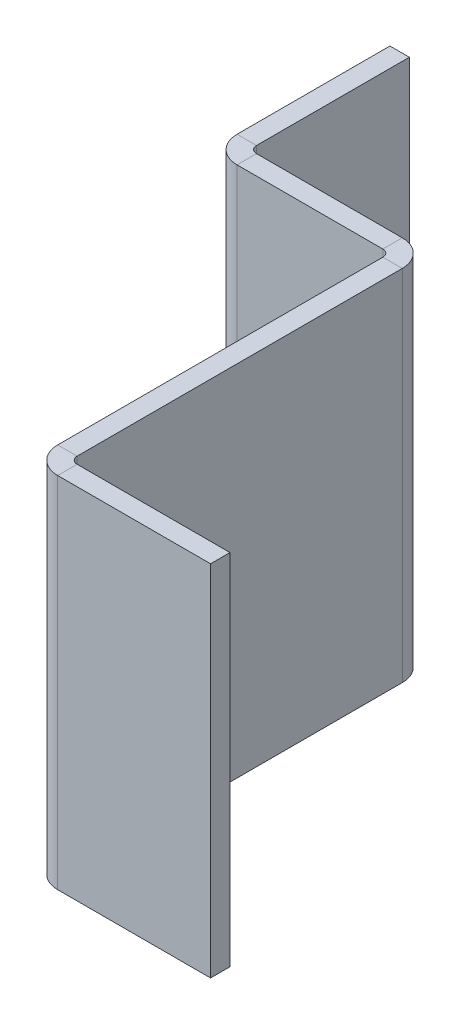
from build123d import *

# Parameters (mm, degrees)
BOSS_EXTRUDE1_DEPTH    = 50.8
CONVERT_SOLID3_DEPTH   = 50.8
CONVERT_SOLID3_2_DEPTH = 50.8


# Read off the part's stored shape, not the designer's step: Convert-Solid3
with BuildPart() as part:
    # Sketch1 → Boss-Extrude1 (new body)
    with BuildSketch(Plane(origin=(0, 0, 0), x_dir=(1, 0, 0), z_dir=(0, 1, 0))):
        Polygon((-9.94664, 28.15336), (15.45336, 28.15336), (15.45336, -22.64664), (38.1, -22.64664), (38.1, -25.4), (12.7, -25.4), (12.7, 25.4), (-12.7, 25.4), (-12.7, 50.8), (-9.94664, 50.8), align=None)
    extrude(amount=BOSS_EXTRUDE1_DEPTH)

    # Convert-Solid3 outline → Convert-Solid3 (cut)
    with BuildSketch(Plane(origin=(0, 0, 0), x_dir=(1, 0, 0), z_dir=(0, 1, 0))):
        with BuildLine():
            ThreePointArc((11.7, 28.15336), (14.354026308, 27.054026308), (15.45336, 24.4))
            Line((15.45336, 24.4), (15.45336, 28.15336))
            Line((15.45336, 28.15336), (11.7, 28.15336))
        make_face()
        with BuildLine():
            Line((-12.7, 25.4), (-8.94664, 25.4))
            ThreePointArc((-8.94664, 25.4), (-11.600666308, 26.499333692), (-12.7, 29.15336))
            Line((-12.7, 29.15336), (-12.7, 25.4))
        make_face()
        with BuildLine():
            ThreePointArc((16.45336, -25.4), (13.799333692, -24.300666308), (12.7, -21.64664))
            Line((12.7, -21.64664), (12.7, -25.4))
            Line((12.7, -25.4), (16.45336, -25.4))
        make_face()
    extrude(amount=CONVERT_SOLID3_DEPTH, mode=Mode.SUBTRACT)

    # Convert-Solid3 2 outline → Convert-Solid3 2 (add)
    with BuildSketch(Plane(origin=(0, 0, 0), x_dir=(1, 0, 0), z_dir=(0, 1, 0))):
        with BuildLine():
            Line((-9.94664, 28.15336), (-8.94664, 28.15336))
            ThreePointArc((-8.94664, 28.15336), (-9.653746781, 28.446253219), (-9.94664, 29.15336))
            Line((-9.94664, 29.15336), (-9.94664, 28.15336))
        make_face()
        with BuildLine():
            ThreePointArc((16.45336, -22.64664), (15.746253219, -22.353746781), (15.45336, -21.64664))
            Line((15.45336, -21.64664), (15.45336, -22.64664))
            Line((15.45336, -22.64664), (16.45336, -22.64664))
        make_face()
        with BuildLine():
            ThreePointArc((11.7, 25.4), (12.407106781, 25.107106781), (12.7, 24.4))
            Line((12.7, 24.4), (12.7, 25.4))
            Line((12.7, 25.4), (11.7, 25.4))
        make_face()
    extrude(amount=CONVERT_SOLID3_2_DEPTH)


solid = part.part
